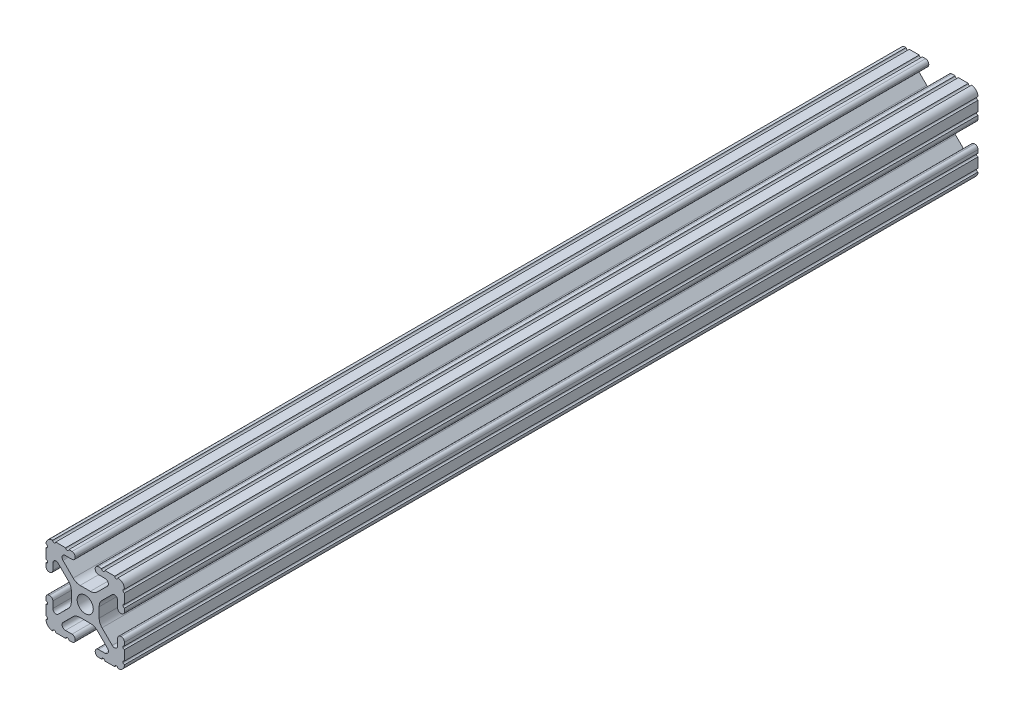
from build123d import *

# Parameters (mm, degrees)
SKETCH1_R               = 2.6035
BOSS_EXTRUDE1_DEPTH     = 457.2
CUT_EXTRUDE2_DEPTH      = 4.318
CUT_EXTRUDE2_DEPTH_BACK = 26.924
SKETCH5_W               = 389.17477671
SKETCH5_H               = 43.327238712
CUT_EXTRUDE3_DEPTH      = 459.081095441


with BuildPart() as part:
    # Sketch1 → Boss-Extrude1 (new, symmetric)
    with BuildSketch(Plane.XY):
        with BuildLine():
            Line((-7.179650497, -8.645192506), (-3.952270251, -5.423690499))
            ThreePointArc((-3.952270251, -5.423690499), (-2.922936451, -4.736929036), (-1.709253557, -4.4958))
            Line((-1.709253557, -4.4958), (1.709253557, -4.4958))
            ThreePointArc((1.709253557, -4.4958), (2.922936451, -4.736929036), (3.952270251, -5.423690499))
            Line((3.952270251, -5.423690499), (7.179650497, -8.645192506))
            ThreePointArc((7.179650497, -8.645192506), (7.41473083, -9.822813117), (6.416408329, -10.4902))
            Line((6.416408329, -10.4902), (4.287512407, -10.4902))
            ThreePointArc((4.287512407, -10.4902), (3.54574862, -10.79744862), (3.2385, -11.539212407))
            Line((3.2385, -11.539212407), (3.2385, -11.650987593))
            ThreePointArc((3.2385, -11.650987593), (3.54574862, -12.39275138), (4.287512407, -12.7))
            Line((4.287512407, -12.7), (5.317126718, -12.7))
            ThreePointArc((5.317126718, -12.7), (5.825126718, -12.192), (6.333126718, -12.7))
            Line((6.333126718, -12.7), (9.550443118, -12.7))
            ThreePointArc((9.550443118, -12.7), (10.058366869, -12.192000006), (10.566443095, -12.699847501))
            ThreePointArc((10.566443095, -12.699847501), (12.082537762, -12.08250727), (12.699846982, -10.566399977))
            ThreePointArc((12.699846982, -10.566399977), (12.192000006, -10.058323491), (12.7, -9.5504))
            Line((12.7, -9.5504), (12.7, -6.3330836))
            ThreePointArc((12.7, -6.3330836), (12.192, -5.8250836), (12.7, -5.3170836))
            Line((12.7, -5.3170836), (12.7, -4.287469289))
            ThreePointArc((12.7, -4.287469289), (12.39275138, -3.545705502), (11.650987593, -3.238456882))
            Line((11.650987593, -3.238456882), (11.539212407, -3.238456882))
            ThreePointArc((11.539212407, -3.238456882), (10.79744862, -3.545705502), (10.4902, -4.287469289))
            Line((10.4902, -4.287469289), (10.4902, -6.402089023))
            ThreePointArc((10.4902, -6.402089023), (9.856505071, -7.351067942), (8.737131347, -7.129408934))
            Line((8.737131347, -7.129408934), (5.441005833, -3.840816462))
            ThreePointArc((5.441005833, -3.840816462), (4.750877967, -2.809883091), (4.5085, -1.593185507))
            Line((4.5085, -1.593185507), (4.5085, 1.593185507))
            ThreePointArc((4.5085, 1.593185507), (4.750877967, 2.809883091), (5.441005833, 3.840816462))
            Line((5.441005833, 3.840816462), (8.737131347, 7.129408934))
            ThreePointArc((8.737131347, 7.129408934), (9.856505071, 7.351067942), (10.4902, 6.402089023))
            Line((10.4902, 6.402089023), (10.4902, 4.287469289))
            ThreePointArc((10.4902, 4.287469289), (10.79744862, 3.545705502), (11.539212407, 3.238456882))
            Line((11.539212407, 3.238456882), (11.650987593, 3.238456882))
            ThreePointArc((11.650987593, 3.238456882), (12.39275138, 3.545705502), (12.7, 4.287469289))
            Line((12.7, 4.287469289), (12.7, 5.3170836))
            ThreePointArc((12.7, 5.3170836), (12.192, 5.8250836), (12.7, 6.3330836))
            Line((12.7, 6.3330836), (12.7, 9.5504))
            ThreePointArc((12.7, 9.5504), (12.192000006, 10.058323491), (12.699846982, 10.566399977))
            ThreePointArc((12.699846982, 10.566399977), (12.082537762, 12.08250727), (10.566443095, 12.699847501))
            ThreePointArc((10.566443095, 12.699847501), (10.058366869, 12.192000006), (9.550443118, 12.7))
            Line((9.550443118, 12.7), (6.333126718, 12.7))
            ThreePointArc((6.333126718, 12.7), (5.825126718, 12.192), (5.317126718, 12.7))
            Line((5.317126718, 12.7), (4.287512407, 12.7))
            ThreePointArc((4.287512407, 12.7), (3.54574862, 12.39275138), (3.2385, 11.650987593))
            Line((3.2385, 11.650987593), (3.2385, 11.539212407))
            ThreePointArc((3.2385, 11.539212407), (3.54574862, 10.79744862), (4.287512407, 10.4902))
            Line((4.287512407, 10.4902), (6.476788598, 10.4902))
            ThreePointArc((6.476788598, 10.4902), (7.432222385, 9.85140422), (7.207036008, 8.724370562))
            Line((7.207036008, 8.724370562), (3.898272566, 5.423169045))
            ThreePointArc((3.898272566, 5.423169045), (2.869120213, 4.736787962), (1.655778399, 4.4958))
            Line((1.655778399, 4.4958), (-1.655778399, 4.4958))
            ThreePointArc((-1.655778399, 4.4958), (-2.869120213, 4.736787962), (-3.898272566, 5.423169045))
            Line((-3.898272566, 5.423169045), (-7.207036008, 8.724370562))
            ThreePointArc((-7.207036008, 8.724370562), (-7.432222385, 9.85140422), (-6.476788598, 10.4902))
            Line((-6.476788598, 10.4902), (-4.287512407, 10.4902))
            ThreePointArc((-4.287512407, 10.4902), (-3.54574862, 10.79744862), (-3.2385, 11.539212407))
            Line((-3.2385, 11.539212407), (-3.2385, 11.650987593))
            ThreePointArc((-3.2385, 11.650987593), (-3.54574862, 12.39275138), (-4.287512407, 12.7))
            Line((-4.287512407, 12.7), (-5.317126718, 12.7))
            ThreePointArc((-5.317126718, 12.7), (-5.825126718, 12.192), (-6.333126718, 12.7))
            Line((-6.333126718, 12.7), (-9.550443118, 12.7))
            ThreePointArc((-9.550443118, 12.7), (-10.058366869, 12.192000006), (-10.566443095, 12.699847501))
            ThreePointArc((-10.566443095, 12.699847501), (-12.082537762, 12.08250727), (-12.699846982, 10.566399977))
            ThreePointArc((-12.699846982, 10.566399977), (-12.192000006, 10.058323491), (-12.7, 9.5504))
            Line((-12.7, 9.5504), (-12.7, 6.3330836))
            ThreePointArc((-12.7, 6.3330836), (-12.192, 5.8250836), (-12.7, 5.3170836))
            Line((-12.7, 5.3170836), (-12.7, 4.287469289))
            ThreePointArc((-12.7, 4.287469289), (-12.39275138, 3.545705502), (-11.650987593, 3.238456882))
            Line((-11.650987593, 3.238456882), (-11.539212407, 3.238456882))
            ThreePointArc((-11.539212407, 3.238456882), (-10.79744862, 3.545705502), (-10.4902, 4.287469289))
            Line((-10.4902, 4.287469289), (-10.4902, 6.402089023))
            ThreePointArc((-10.4902, 6.402089023), (-9.856505071, 7.351067942), (-8.737131347, 7.129408934))
            Line((-8.737131347, 7.129408934), (-5.441005833, 3.840816462))
            ThreePointArc((-5.441005833, 3.840816462), (-4.750877967, 2.809883091), (-4.5085, 1.593185507))
            Line((-4.5085, 1.593185507), (-4.5085, -1.593185507))
            ThreePointArc((-4.5085, -1.593185507), (-4.750877967, -2.809883091), (-5.441005833, -3.840816462))
            Line((-5.441005833, -3.840816462), (-8.737131347, -7.129408934))
            ThreePointArc((-8.737131347, -7.129408934), (-9.856505071, -7.351067942), (-10.4902, -6.402089023))
            Line((-10.4902, -6.402089023), (-10.4902, -4.287469289))
            ThreePointArc((-10.4902, -4.287469289), (-10.79744862, -3.545705502), (-11.539212407, -3.238456882))
            Line((-11.539212407, -3.238456882), (-11.650987593, -3.238456882))
            ThreePointArc((-11.650987593, -3.238456882), (-12.39275138, -3.545705502), (-12.7, -4.287469289))
            Line((-12.7, -4.287469289), (-12.7, -5.3170836))
            ThreePointArc((-12.7, -5.3170836), (-12.192, -5.8250836), (-12.7, -6.3330836))
            Line((-12.7, -6.3330836), (-12.7, -9.5504))
            ThreePointArc((-12.7, -9.5504), (-12.192000006, -10.058323491), (-12.699846982, -10.566399977))
            ThreePointArc((-12.699846982, -10.566399977), (-12.082537762, -12.08250727), (-10.566443095, -12.699847501))
            ThreePointArc((-10.566443095, -12.699847501), (-10.058366869, -12.192000006), (-9.550443118, -12.7))
            Line((-9.550443118, -12.7), (-6.333126718, -12.7))
            ThreePointArc((-6.333126718, -12.7), (-5.825126718, -12.192), (-5.317126718, -12.7))
            Line((-5.317126718, -12.7), (-4.287512407, -12.7))
            ThreePointArc((-4.287512407, -12.7), (-3.54574862, -12.39275138), (-3.2385, -11.650987593))
            Line((-3.2385, -11.650987593), (-3.2385, -11.539212407))
            ThreePointArc((-3.2385, -11.539212407), (-3.54574862, -10.79744862), (-4.287512407, -10.4902))
            Line((-4.287512407, -10.4902), (-6.416408329, -10.4902))
            ThreePointArc((-6.416408329, -10.4902), (-7.41473083, -9.822813117), (-7.179650497, -8.645192506))
        make_face()
        Circle(SKETCH1_R, mode=Mode.SUBTRACT)
    extrude(amount=BOSS_EXTRUDE1_DEPTH, both=True)

    # Sketch3 → Cut-Extrude2 (cut, two sides: drawn at the far end of the back side and taken through both)
    with BuildSketch(Plane.ZY.offset(12.7).offset(-CUT_EXTRUDE2_DEPTH_BACK)):
        Polygon((-203.2, -27.552777595), (-203.2, 21.158109763), (-461.090893327, 21.158109763), (-461.090893327, -25.4), align=None)
    extrude(amount=CUT_EXTRUDE2_DEPTH + CUT_EXTRUDE2_DEPTH_BACK, mode=Mode.SUBTRACT)

    # Sketch5 → Cut-Extrude3 (cut, through all)
    with BuildSketch(Plane(origin=(12.7, 0, 0), x_dir=(0, 0, -1), z_dir=(1, 0, 0))):
        with Locations((13.731586153, 2.312510515)):
            Rectangle(SKETCH5_W, SKETCH5_H)
    extrude(amount=-CUT_EXTRUDE3_DEPTH, mode=Mode.SUBTRACT)


solid = part.part
